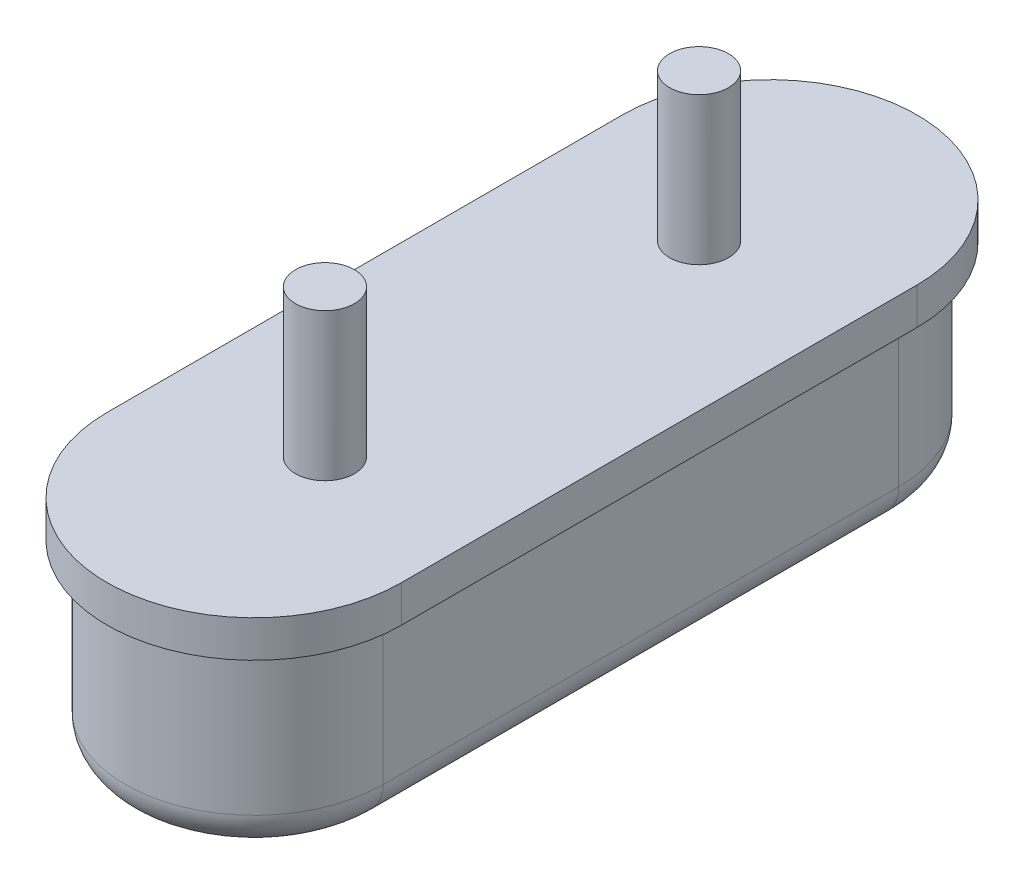
from build123d import *

# Parameters (mm, degrees)
BOSS_EXTRUDE1_DEPTH = 3
CUT_EXTRUDE1_START  = -2.5
CUT_EXTRUDE1_DEPTH  = 2.5
FILLET1_R           = 0.5
SKETCH3_R           = 0.4
BOSS_EXTRUDE2_DEPTH = 2
CUT_EXTRUDE2_DEPTH  = 0.05
FILLET2_R           = 0.1


with BuildPart() as part:
    # Sketch1 → Boss-Extrude1 (new body)
    with BuildSketch(Plane.XZ):
        with BuildLine():
            Line((2, 3.5), (2, -3.5))
            ThreePointArc((2, -3.5), (0, -5.5), (-2, -3.5))
            Line((-2, -3.5), (-2, 3.5))
            ThreePointArc((-2, 3.5), (0, 5.5), (2, 3.5))
        make_face()
    extrude(amount=BOSS_EXTRUDE1_DEPTH)

    # Sketch2 → Cut-Extrude1 (cut)
    with BuildSketch(Plane.XZ.offset(3).offset(CUT_EXTRUDE1_START)):
        with BuildLine():
            Line((2, 3.5), (2, -3.5))
            ThreePointArc((2, -3.5), (0, -5.5), (-2, -3.5))
            Line((-2, -3.5), (-2, 3.5))
            ThreePointArc((-2, 3.5), (0, 5.5), (2, 3.5))
        make_face()
        with BuildLine():
            Line((1.75, 3.5), (1.75, -3.5))
            ThreePointArc((1.75, -3.5), (0, -5.25), (-1.75, -3.5))
            Line((-1.75, -3.5), (-1.75, 3.5))
            ThreePointArc((-1.75, 3.5), (0, 5.25), (1.75, 3.5))
        make_face(mode=Mode.SUBTRACT)
    extrude(amount=CUT_EXTRUDE1_DEPTH, mode=Mode.SUBTRACT)

    # Fillet1
    fillet1_edges = [part.edges().sort_by_distance(p)[0] for p in [
        (0, -3, -5.25),
        (1.75, -3, 0),
        (0, -3, 5.25),
        (-1.75, -3, 0),
    ]]
    fillet(fillet1_edges, radius=FILLET1_R)

    # Sketch3 → Boss-Extrude2 (add)
    with BuildSketch(Plane(origin=(0, 0, 0), x_dir=(1, 0, 0), z_dir=(0, 1, 0))):
        with Locations((0, 2.54)):
            Circle(SKETCH3_R)
        with Locations((0, -2.54)):
            Circle(SKETCH3_R)
    extrude(amount=BOSS_EXTRUDE2_DEPTH)

    # Sketch4 → Cut-Extrude2 (cut)
    # profile 1 of 10: a face of its own
    with BuildSketch(Plane.XZ.offset(3)):
        with BuildLine():
            add(Edge.make_bspline(
                [(-0.455693493, -2.719669553), (-0.454052299, -2.717742187), (-0.45091746, -2.714060734), (-0.445315879, -2.709924595), (-0.439274547, -2.707354954), (-0.435097795, -2.707003283), (-0.433005137, -2.706827087)],
                knots=[0, 0, 0, 0, 1.123151834, 2.145327845, 3.070762522, 4, 4, 4, 4], degree=3))
            add(Edge.make_bspline(
                [(-0.433005137, -2.706827087), (-0.429264089, -2.707058472), (-0.422218418, -2.707494248), (-0.412509892, -2.711149986), (-0.404998663, -2.717805901), (-0.40187447, -2.72354653), (-0.400256849, -2.726518868)],
                knots=[0, 0, 0, 0, 1.103829111, 2.078887027, 3.005301256, 4, 4, 4, 4], degree=3))
            add(Edge.make_bspline(
                [(-0.400256849, -2.726518868), (-0.399431529, -2.728776269), (-0.398108355, -2.732395388), (-0.397647656, -2.736212711), (-0.397474315, -2.737649005)],
                knots=[0, 0, 0, 0, 1.247486438, 2, 2, 2, 2], degree=3))
            add(Edge.make_bspline(
                [(-0.397474315, -2.737649005), (-0.397879817, -2.740597373), (-0.398883448, -2.74789468), (-0.403174333, -2.758696795), (-0.407427859, -2.769118295), (-0.409352206, -2.775735841), (-0.41010274, -2.778316813)],
                knots=[0, 0, 0, 0, 0.834115317, 2.06446299, 3.24510253, 4, 4, 4, 4], degree=3))
            add(Edge.make_bspline(
                [(-0.41010274, -2.778316813), (-0.41552906, -2.796866469), (-0.426127974, -2.833098427), (-0.43680466, -2.887387776), (-0.443979055, -2.939867782), (-0.444801637, -2.974355929), (-0.445205479, -2.991287704)],
                knots=[0, 0, 0, 0, 1.070143053, 2.090247768, 3.06241719, 4, 4, 4, 4], degree=3))
            add(Edge.make_bspline(
                [(-0.445205479, -2.991287704), (-0.445205479, -2.992714644), (-0.445205479, -2.996496037), (-0.445205479, -3.00027743), (-0.445205479, -3.002631882)],
                knots=[0, 0, 0, 0, 0.754716981, 2, 2, 2, 2], degree=3))
            add(Edge.make_bspline(
                [(-0.445205479, -3.002631882), (-0.445205479, -3.004700946), (-0.445205479, -3.008410991), (-0.445205479, -3.012121037), (-0.445205479, -3.013762019)],
                knots=[0, 0, 0, 0, 1.115384615, 2, 2, 2, 2], degree=3))
            add(Edge.make_bspline(
                [(-0.445205479, -3.013762019), (-0.444604909, -3.018918862), (-0.443409192, -3.02918598), (-0.439628474, -3.044126756), (-0.43478806, -3.058701938), (-0.428039153, -3.072519701), (-0.420132183, -3.085918984), (-0.410637769, -3.098599105), (-0.399588733, -3.110622364), (-0.383382492, -3.125745698), (-0.361097963, -3.141813743), (-0.332417147, -3.156244113), (-0.302022322, -3.165024502), (-0.281234733, -3.166063777), (-0.270761986, -3.166587361)],
                knots=[0, 0, 0, 0, 0.737223551, 1.467789844, 2.186217636, 2.916572712, 3.648826552, 4.395270522, 5.163445613, 5.967152366, 7.54345389, 9.049273149, 10.513429621, 12, 12, 12, 12], degree=3))
            add(Edge.make_bspline(
                [(-0.270761986, -3.166587361), (-0.264258122, -3.166449336), (-0.251473309, -3.166178017), (-0.232768732, -3.163251881), (-0.214901332, -3.158799551), (-0.197904959, -3.152541012), (-0.181683722, -3.14462467), (-0.166496105, -3.134642809), (-0.151942713, -3.123092156), (-0.143306038, -3.114042059), (-0.138912671, -3.109438389)],
                knots=[0, 0, 0, 0, 1.05273353, 2.069385422, 3.058871978, 4.031475575, 4.998017562, 5.975757643, 6.970293492, 8, 8, 8, 8], degree=3))
            Line((-0.138912671, -3.109438389), (-0.119006849, -3.08246921))
            Line((-0.119006849, -3.08246921), (0.045376712, -2.755842498))
            add(Edge.make_bspline(
                [(0.045376712, -2.755842498), (0.051595303, -2.747117368), (0.063738078, -2.730080181), (0.085032192, -2.707745841), (0.107702136, -2.688358588), (0.132555302, -2.672972318), (0.158970523, -2.660734546), (0.18715264, -2.652286987), (0.217049464, -2.646943789), (0.237562162, -2.646345832), (0.24807363, -2.646039416)],
                knots=[0, 0, 0, 0, 1.066206558, 2.081935809, 3.065751716, 4.030169453, 4.984343245, 5.957937679, 6.953571388, 8, 8, 8, 8], degree=3))
            add(Edge.make_bspline(
                [(0.24807363, -2.646039416), (0.25293351, -2.646064039), (0.261027881, -2.646105049), (0.269053326, -2.647128668), (0.272260274, -2.647537704)],
                knots=[0, 0, 0, 0, 1.200805017, 2, 2, 2, 2], degree=3))
            add(Edge.make_bspline(
                [(0.272260274, -2.647537704), (0.282382778, -2.648952883), (0.302688959, -2.651791793), (0.332326756, -2.661533665), (0.360977572, -2.675633356), (0.388307111, -2.693762263), (0.413506675, -2.714935284), (0.435149021, -2.739050093), (0.453293365, -2.765211797), (0.462032313, -2.784374261), (0.466395548, -2.793941813)],
                knots=[0, 0, 0, 0, 0.961840898, 1.929494427, 2.924998625, 3.963894652, 5.013530698, 6.018236918, 7.01053329, 8, 8, 8, 8], degree=3))
            add(Edge.make_bspline(
                [(0.466395548, -2.793941813), (0.469497243, -2.802089979), (0.475661264, -2.818282885), (0.481735877, -2.84343494), (0.485523249, -2.868882721), (0.486041324, -2.885966163), (0.48630137, -2.894541128)],
                knots=[0, 0, 0, 0, 1.013198682, 2.013536909, 3.002902805, 4, 4, 4, 4], degree=3))
            add(Edge.make_bspline(
                [(0.48630137, -2.894541128), (0.485731245, -2.908765347), (0.484541458, -2.938449734), (0.476816912, -2.984453083), (0.464347825, -3.033607587), (0.452748629, -3.066854882), (0.446703767, -3.084181539)],
                knots=[0, 0, 0, 0, 0.876921522, 1.830039204, 2.869136069, 4, 4, 4, 4], degree=3))
            add(Edge.make_bspline(
                [(0.446703767, -3.084181539), (0.441342974, -3.097543204), (0.430823321, -3.123763216), (0.411748657, -3.161036441), (0.390514575, -3.195890285), (0.374123667, -3.217236752), (0.366010274, -3.227803115)],
                knots=[0, 0, 0, 0, 1.043998492, 2.048670962, 3.034104776, 4, 4, 4, 4], degree=3))
            add(Edge.make_bspline(
                [(0.366010274, -3.227803115), (0.363489839, -3.229872548), (0.358379153, -3.234068738), (0.351795633, -3.234740196), (0.348458904, -3.235080512)],
                knots=[0, 0, 0, 0, 0.986338914, 2, 2, 2, 2], degree=3))
            add(Edge.make_bspline(
                [(0.348458904, -3.235080512), (0.346869074, -3.234945119), (0.343284634, -3.23463986), (0.340008166, -3.233135242), (0.338184932, -3.232297978)],
                knots=[0, 0, 0, 0, 0.887072906, 2, 2, 2, 2], degree=3))
            add(Edge.make_bspline(
                [(0.338184932, -3.232297978), (0.334650287, -3.231008869), (0.328100806, -3.22862023), (0.320261788, -3.222045189), (0.315415317, -3.213492588), (0.314902793, -3.207102079), (0.314640411, -3.203830512)],
                knots=[0, 0, 0, 0, 1.12649361, 2.087323689, 3.020821353, 4, 4, 4, 4], degree=3))
            add(Edge.make_bspline(
                [(0.314640411, -3.203830512), (0.314838601, -3.200937569), (0.315246824, -3.194978821), (0.317672969, -3.189517237), (0.318921233, -3.186707224)],
                knots=[0, 0, 0, 0, 0.970990099, 2, 2, 2, 2], degree=3))
            add(Edge.make_bspline(
                [(0.318921233, -3.186707224), (0.326807584, -3.174543932), (0.342407563, -3.150483742), (0.362400266, -3.112903022), (0.379727574, -3.074955568), (0.393640129, -3.036360341), (0.404400809, -2.997202152), (0.412046637, -2.957558757), (0.417017162, -2.917355874), (0.41754368, -2.890346195), (0.417808219, -2.876775717)],
                knots=[0, 0, 0, 0, 1.052998489, 2.082934739, 3.090014684, 4.082250997, 5.060833939, 6.038001165, 7.014232617, 8, 8, 8, 8], degree=3))
            add(Edge.make_bspline(
                [(0.417808219, -2.876775717), (0.417213323, -2.87126207), (0.416036701, -2.860356844), (0.412220457, -2.844499493), (0.407454525, -2.829115357), (0.400579211, -2.814572204), (0.392827436, -2.800374527), (0.383176895, -2.787023133), (0.372295332, -2.774139318), (0.355898719, -2.758174923), (0.333778074, -2.740759943), (0.304374955, -2.725638218), (0.273191895, -2.716219333), (0.251634037, -2.715096866), (0.240796233, -2.714532567)],
                knots=[0, 0, 0, 0, 0.759082945, 1.501360362, 2.230976094, 2.961573592, 3.70127141, 4.444513868, 5.214348523, 6.009346189, 7.577583571, 9.051056227, 10.517474458, 12, 12, 12, 12], degree=3))
            add(Edge.make_bspline(
                [(0.240796233, -2.714532567), (0.231204054, -2.714963732), (0.212397965, -2.71580906), (0.185169632, -2.721863862), (0.159810167, -2.732141581), (0.144893606, -2.742224993), (0.137414384, -2.747280854)],
                knots=[0, 0, 0, 0, 1.043203148, 2.045267505, 3.019889533, 4, 4, 4, 4], degree=3))
            add(Edge.make_bspline(
                [(0.137414384, -2.747280854), (0.131568128, -2.752130075), (0.119528669, -2.762116294), (0.103531649, -2.780532877), (0.088286599, -2.801605995), (0.079602792, -2.817312838), (0.075128425, -2.825405854)],
                knots=[0, 0, 0, 0, 0.904242437, 1.862147382, 2.898462603, 4, 4, 4, 4], degree=3))
            add(Edge.make_bspline(
                [(0.075128425, -2.825405854), (0.067965018, -2.84012456), (0.053596477, -2.869647707), (0.038713233, -2.898914762), (0.03125, -2.913590786)],
                knots=[0, 0, 0, 0, 0.997095991, 2, 2, 2, 2], degree=3))
            Line((0.03125, -2.913590786), (-0.070633562, -3.119926402))
            add(Edge.make_bspline(
                [(-0.070633562, -3.119926402), (-0.076830757, -3.129089484), (-0.088921225, -3.146966271), (-0.110444373, -3.170323977), (-0.133304988, -3.190602734), (-0.158483121, -3.206671972), (-0.185176295, -3.21951854), (-0.213806057, -3.228431924), (-0.244196242, -3.234283049), (-0.26516862, -3.234810596), (-0.275898973, -3.235080512)],
                knots=[0, 0, 0, 0, 1.075829312, 2.098897729, 3.083886839, 4.04363121, 4.997725526, 5.960157101, 6.956330352, 8, 8, 8, 8], degree=3))
            add(Edge.make_bspline(
                [(-0.275898973, -3.235080512), (-0.279754506, -3.234983174), (-0.287763678, -3.234780972), (-0.295736689, -3.2339916), (-0.299871575, -3.233582224)],
                knots=[0, 0, 0, 0, 0.962779383, 2, 2, 2, 2], degree=3))
            add(Edge.make_bspline(
                [(-0.299871575, -3.233582224), (-0.310137043, -3.23201127), (-0.330721536, -3.228861165), (-0.36065002, -3.218933432), (-0.389598679, -3.205074659), (-0.417085208, -3.187422329), (-0.442455469, -3.166845972), (-0.463944565, -3.143160943), (-0.482301246, -3.117566324), (-0.490949733, -3.098616771), (-0.495291096, -3.089104484)],
                knots=[0, 0, 0, 0, 0.979088105, 1.963284269, 2.963623745, 4.002614083, 5.041080185, 6.037533597, 7.014882131, 8, 8, 8, 8], degree=3))
            add(Edge.make_bspline(
                [(-0.495291096, -3.089104484), (-0.498212261, -3.081317721), (-0.504166334, -3.06544633), (-0.50929197, -3.039892432), (-0.513292081, -3.012818122), (-0.513560402, -2.994087602), (-0.51369863, -2.984438389)],
                knots=[0, 0, 0, 0, 0.932067178, 1.899788189, 2.918055019, 4, 4, 4, 4], degree=3))
            add(Edge.make_bspline(
                [(-0.51369863, -2.984438389), (-0.513351448, -2.971294231), (-0.512620575, -2.943623706), (-0.506798088, -2.900462903), (-0.498097784, -2.853554849), (-0.489789047, -2.821435823), (-0.485445205, -2.804643868)],
                knots=[0, 0, 0, 0, 0.864098311, 1.819063323, 2.859797586, 4, 4, 4, 4], degree=3))
            add(Edge.make_bspline(
                [(-0.485445205, -2.804643868), (-0.483068979, -2.796281435), (-0.478540272, -2.780343978), (-0.471302276, -2.757817199), (-0.463883951, -2.737776771), (-0.458327435, -2.725492592), (-0.455693493, -2.719669553)],
                knots=[0, 0, 0, 0, 1.157267687, 2.20556675, 3.149389165, 4, 4, 4, 4], degree=3))
        make_face()
    # profile 2 of 10: a face of its own
    with BuildSketch(Plane.XZ.offset(3)):
        with BuildLine():
            add(Edge.make_bspline(
                [(-0.51369863, -2.094241471), (-0.513528222, -2.087599512), (-0.513187967, -2.074337478), (-0.510610524, -2.054531794), (-0.505946846, -2.035059532), (-0.500129444, -2.015685116), (-0.491968912, -1.996856203), (-0.482619021, -1.978065743), (-0.471219544, -1.959714581), (-0.453902707, -1.93603194), (-0.429982687, -1.908551441), (-0.397832755, -1.880337534), (-0.362712877, -1.857494471), (-0.337369192, -1.846803273), (-0.324700342, -1.841458937)],
                knots=[0, 0, 0, 0, 0.715319174, 1.428281714, 2.145949783, 2.870252072, 3.603830021, 4.353019454, 5.12930605, 5.927051846, 7.51164333, 9.042016745, 10.521357733, 12, 12, 12, 12], degree=3))
            add(Edge.make_bspline(
                [(-0.324700342, -1.841458937), (-0.316746786, -1.838832877), (-0.300867738, -1.833590024), (-0.276598968, -1.828087667), (-0.252092411, -1.824731289), (-0.235741178, -1.824325495), (-0.227525685, -1.824121608)],
                knots=[0, 0, 0, 0, 1.012942066, 2.022309834, 3.006331903, 4, 4, 4, 4], degree=3))
            add(Edge.make_bspline(
                [(-0.227525685, -1.824121608), (-0.217591986, -1.824333184), (-0.198065814, -1.824749069), (-0.169504279, -1.829070485), (-0.142066305, -1.835374892), (-0.115882898, -1.844539281), (-0.091149686, -1.856774919), (-0.067399325, -1.871150849), (-0.04484105, -1.888205518), (-0.031255164, -1.901521469), (-0.024400685, -1.908239758)],
                knots=[0, 0, 0, 0, 1.05355145, 2.070913016, 3.059082178, 4.038625458, 5.007219172, 5.982538493, 6.982131288, 8, 8, 8, 8], degree=3))
            add(Edge.make_bspline(
                [(-0.024400685, -1.908239758), (-0.017544458, -1.91582044), (-0.003963703, -1.930836186), (0.013625134, -1.955366775), (0.028425985, -1.981227202), (0.040822292, -2.008227908), (0.049897859, -2.036826961), (0.056805492, -2.066504025), (0.0609805, -2.097547677), (0.061420306, -2.118629456), (0.061643836, -2.12934421)],
                knots=[0, 0, 0, 0, 1.007274285, 1.995199957, 2.969022675, 3.941930145, 4.918594813, 5.922053884, 6.94388981, 8, 8, 8, 8], degree=3))
            Line((0.061643836, -2.12934421), (0.061643836, -2.344669553))
            Line((0.061643836, -2.344669553), (0.464469178, -2.344669553))
            add(Edge.make_bspline(
                [(0.464469178, -2.344669553), (0.467067359, -2.345719868), (0.472262861, -2.347820151), (0.478608627, -2.354272906), (0.483454632, -2.362913875), (0.485312547, -2.369725675), (0.48630137, -2.37335106)],
                knots=[0, 0, 0, 0, 0.882085567, 1.763879777, 2.80988923, 4, 4, 4, 4], degree=3))
            add(Edge.make_bspline(
                [(0.48630137, -2.37335106), (0.485826357, -2.378328512), (0.484879848, -2.388246575), (0.478963665, -2.400073086), (0.469979311, -2.407211367), (0.459398505, -2.410840857), (0.445414835, -2.412651816), (0.434937843, -2.412980953), (0.429152397, -2.413162704)],
                knots=[0, 0, 0, 0, 1.118428376, 2.228578797, 2.843546727, 3.649160504, 4.701854983, 6, 6, 6, 6], degree=3))
            Line((0.429152397, -2.413162704), (-0.490796233, -2.413162704))
            add(Edge.make_bspline(
                [(-0.490796233, -2.413162704), (-0.494796377, -2.411371877), (-0.502827235, -2.407776539), (-0.508212975, -2.400816785), (-0.510916096, -2.397323663)],
                knots=[0, 0, 0, 0, 0.996193528, 2, 2, 2, 2], degree=3))
            Line((-0.510916096, -2.397323663), (-0.51369863, -2.387263731))
            Line((-0.51369863, -2.387263731), (-0.51369863, -2.094241471))
        make_face()
        with BuildLine():
            Line((-0.445205479, -2.094669553), (-0.445205479, -2.344669553))
            Line((-0.445205479, -2.344669553), (-0.006849315, -2.344669553))
            Line((-0.006849315, -2.344669553), (-0.006849315, -2.117143868))
            add(Edge.make_bspline(
                [(-0.006849315, -2.117143868), (-0.007075293, -2.10870861), (-0.007522315, -2.092022285), (-0.011723941, -2.06744246), (-0.018643158, -2.043786719), (-0.028072273, -2.020894969), (-0.040437547, -1.999019949), (-0.055228774, -1.97790999), (-0.072995193, -1.957845277), (-0.086425581, -1.945575893), (-0.093321918, -1.939275717)],
                knots=[0, 0, 0, 0, 0.990168394, 1.958715646, 2.918778046, 3.88059452, 4.859814791, 5.864243612, 6.903315664, 8, 8, 8, 8], degree=3))
            add(Edge.make_bspline(
                [(-0.093321918, -1.939275717), (-0.097955811, -1.935532797), (-0.107183124, -1.92807965), (-0.122317055, -1.918787474), (-0.137972181, -1.910519546), (-0.154508994, -1.903815256), (-0.171934055, -1.899017804), (-0.190025203, -1.895375297), (-0.208834005, -1.892859162), (-0.22166693, -1.892696938), (-0.228167808, -1.892614758)],
                knots=[0, 0, 0, 0, 0.979790498, 1.951023092, 2.917769928, 3.892831032, 4.881942733, 5.888684581, 6.930453953, 8, 8, 8, 8], degree=3))
            add(Edge.make_bspline(
                [(-0.228167808, -1.892614758), (-0.235603172, -1.892800211), (-0.250188954, -1.89316401), (-0.271579481, -1.896639425), (-0.292307348, -1.901483358), (-0.305352529, -1.906848517), (-0.311857877, -1.909524005)],
                knots=[0, 0, 0, 0, 1.036956728, 2.034174045, 3.019685471, 4, 4, 4, 4], degree=3))
            add(Edge.make_bspline(
                [(-0.311857877, -1.909524005), (-0.320856811, -1.913826118), (-0.3388743, -1.922439724), (-0.363430747, -1.940321164), (-0.386211157, -1.961306117), (-0.40639612, -1.985452245), (-0.423609078, -2.011333133), (-0.435836789, -2.038605048), (-0.443962501, -2.06637788), (-0.44479245, -2.085268503), (-0.445205479, -2.094669553)],
                knots=[0, 0, 0, 0, 0.994982126, 1.992133557, 3.021473572, 4.084156812, 5.130374186, 6.11645094, 7.062638743, 8, 8, 8, 8], degree=3))
        make_face(mode=Mode.SUBTRACT)
    # profile 3 of 10: a face of its own
    with BuildSketch(Plane.XZ.offset(3)):
        with BuildLine():
            add(Edge.make_bspline(
                [(-0.495077055, -1.013547978), (-0.492676025, -1.012714013), (-0.48856912, -1.011287535), (-0.484244809, -1.010918662), (-0.48244863, -1.010765443)],
                knots=[0, 0, 0, 0, 1.169264719, 2, 2, 2, 2], degree=3))
            add(Edge.make_bspline(
                [(-0.48244863, -1.010765443), (-0.478616231, -1.011167432), (-0.47068719, -1.011999127), (-0.464329371, -1.016830761), (-0.461044521, -1.019327087)],
                knots=[0, 0, 0, 0, 0.966674081, 2, 2, 2, 2], degree=3))
            Line((-0.461044521, -1.019327087), (-0.126284247, -1.322195238))
            Line((-0.126284247, -1.322195238), (0.447773973, -1.006484621))
            add(Edge.make_bspline(
                [(0.447773973, -1.006484621), (0.451060806, -1.006553735), (0.457023404, -1.006679113), (0.465134169, -1.007847237), (0.471530794, -1.010100011), (0.474782539, -1.012480133), (0.476241438, -1.013547978)],
                knots=[0, 0, 0, 0, 1.31758118, 2.390205438, 3.277763939, 4, 4, 4, 4], degree=3))
            add(Edge.make_bspline(
                [(0.476241438, -1.013547978), (0.479148913, -1.017972867), (0.485005098, -1.026885403), (0.485867256, -1.037517917), (0.48630137, -1.042871608)],
                knots=[0, 0, 0, 0, 0.992958702, 2, 2, 2, 2], degree=3))
            add(Edge.make_bspline(
                [(0.48630137, -1.042871608), (0.485290299, -1.04571805), (0.48340091, -1.051037202), (0.478736666, -1.057697161), (0.473035183, -1.062729634), (0.468465079, -1.064474203), (0.466181507, -1.065345923)],
                knots=[0, 0, 0, 0, 1.148250895, 2.145738409, 3.073469419, 4, 4, 4, 4], degree=3))
            Line((0.466181507, -1.065345923), (-0.078981164, -1.362863046))
            Line((-0.078981164, -1.362863046), (0.101241438, -1.522751745))
            Line((0.101241438, -1.522751745), (0.463398973, -1.522751745))
            add(Edge.make_bspline(
                [(0.463398973, -1.522751745), (0.466653472, -1.524229421), (0.473479217, -1.527328588), (0.480168108, -1.536825878), (0.485477562, -1.547132029), (0.486032952, -1.55479373), (0.48630137, -1.558496608)],
                knots=[0, 0, 0, 0, 0.938899355, 1.969177755, 3.018509487, 4, 4, 4, 4], degree=3))
            add(Edge.make_bspline(
                [(0.48630137, -1.558496608), (0.486175281, -1.560230416), (0.485899093, -1.56402818), (0.484356942, -1.567516772), (0.483518836, -1.569412704)],
                knots=[0, 0, 0, 0, 0.913067909, 2, 2, 2, 2], degree=3))
            add(Edge.make_bspline(
                [(0.483518836, -1.569412704), (0.481727308, -1.572883526), (0.477938531, -1.580223728), (0.465275313, -1.586711363), (0.449013289, -1.590888853), (0.436406883, -1.591117308), (0.429366438, -1.591244895)],
                knots=[0, 0, 0, 0, 0.740913191, 1.566905858, 2.641161788, 4, 4, 4, 4], degree=3))
            Line((0.429366438, -1.591244895), (-0.489511986, -1.591244895))
            add(Edge.make_bspline(
                [(-0.489511986, -1.591244895), (-0.493151288, -1.589611605), (-0.500177494, -1.586458297), (-0.508116314, -1.578213673), (-0.513045003, -1.567820226), (-0.51347167, -1.560197158), (-0.51369863, -1.556142156)],
                knots=[0, 0, 0, 0, 1.040780064, 2.009378633, 2.941112224, 4, 4, 4, 4], degree=3))
            add(Edge.make_bspline(
                [(-0.51369863, -1.556142156), (-0.513576549, -1.552596651), (-0.513346742, -1.545922558), (-0.509433651, -1.537091849), (-0.503657572, -1.529750039), (-0.498154907, -1.527118092), (-0.495291096, -1.52574832)],
                knots=[0, 0, 0, 0, 1.112554645, 2.094284351, 3.00818775, 4, 4, 4, 4], degree=3))
            Line((-0.495291096, -1.52574832), (-0.479666096, -1.522751745))
            Line((-0.479666096, -1.522751745), (0.004494863, -1.522751745))
            Line((0.004494863, -1.522751745), (-0.013912671, -1.504558252))
            Line((-0.013912671, -1.504558252), (-0.506635274, -1.061279142))
            add(Edge.make_bspline(
                [(-0.506635274, -1.061279142), (-0.508679512, -1.057369846), (-0.511953026, -1.051109747), (-0.513222075, -1.044187002), (-0.51369863, -1.041587361)],
                knots=[0, 0, 0, 0, 1.248956491, 2, 2, 2, 2], degree=3))
            add(Edge.make_bspline(
                [(-0.51369863, -1.041587361), (-0.513439183, -1.040153873), (-0.512709078, -1.036119932), (-0.510223859, -1.02896096), (-0.504912832, -1.019984972), (-0.498526262, -1.015805301), (-0.495077055, -1.013547978)],
                knots=[0, 0, 0, 0, 0.500659177, 1.408892098, 2.600615059, 4, 4, 4, 4], degree=3))
        make_face()
    # profile 4 of 10: a face of its own
    with BuildSketch(Plane.XZ.offset(3)):
        with BuildLine():
            Line((-0.496575342, -0.485936676), (-0.48244863, -0.481655854))
            Line((-0.48244863, -0.481655854), (0.463613014, -0.481655854))
            add(Edge.make_bspline(
                [(0.463613014, -0.481655854), (0.466686269, -0.483038704), (0.474251864, -0.486442938), (0.479126224, -0.493243048), (0.482020548, -0.497280854)],
                knots=[0, 0, 0, 0, 0.812429336, 2, 2, 2, 2], degree=3))
            add(Edge.make_bspline(
                [(0.482020548, -0.497280854), (0.483268997, -0.500453159), (0.485813804, -0.506919505), (0.486136821, -0.513863404), (0.48630137, -0.517400717)],
                knots=[0, 0, 0, 0, 0.981173826, 2, 2, 2, 2], degree=3))
            add(Edge.make_bspline(
                [(0.48630137, -0.517400717), (0.486175281, -0.519134526), (0.485899093, -0.52293229), (0.484356942, -0.526420882), (0.483518836, -0.528316813)],
                knots=[0, 0, 0, 0, 0.913067909, 2, 2, 2, 2], degree=3))
            add(Edge.make_bspline(
                [(0.483518836, -0.528316813), (0.481727308, -0.531787636), (0.477938531, -0.539127837), (0.465275313, -0.545615472), (0.449013289, -0.549792962), (0.436406883, -0.550021417), (0.429366438, -0.550149005)],
                knots=[0, 0, 0, 0, 0.740913191, 1.566905858, 2.641161788, 4, 4, 4, 4], degree=3))
            Line((0.429366438, -0.550149005), (-0.404751712, -0.550149005))
            Line((-0.404751712, -0.550149005), (-0.247431507, -0.706613046))
            add(Edge.make_bspline(
                [(-0.247431507, -0.706613046), (-0.246183018, -0.708988897), (-0.243646875, -0.713815126), (-0.243317776, -0.719259686), (-0.243150685, -0.722024005)],
                knots=[0, 0, 0, 0, 0.984557722, 2, 2, 2, 2], degree=3))
            add(Edge.make_bspline(
                [(-0.243150685, -0.722024005), (-0.2432256, -0.722093394), (-0.243788898, -0.722615142), (-0.243674535, -0.724949736), (-0.244888716, -0.728454255), (-0.245844223, -0.733626221), (-0.247805494, -0.739208783), (-0.251379314, -0.744440599), (-0.256695836, -0.748475206), (-0.260872681, -0.750361436), (-0.263056507, -0.751347635)],
                knots=[0, 0, 0, 0, 0.064375906, 0.484055469, 1.323414594, 2.493746615, 3.804393269, 5.079783794, 6.473191324, 8, 8, 8, 8], degree=3))
            add(Edge.make_bspline(
                [(-0.263056507, -0.751347635), (-0.264993956, -0.752596196), (-0.268846645, -0.755079006), (-0.27341428, -0.755446012), (-0.275684932, -0.755628457)],
                knots=[0, 0, 0, 0, 1.005764603, 2, 2, 2, 2], degree=3))
            add(Edge.make_bspline(
                [(-0.275684932, -0.755628457), (-0.279764303, -0.754869286), (-0.289096655, -0.753132536), (-0.295990934, -0.746512351), (-0.299871575, -0.742785991)],
                knots=[0, 0, 0, 0, 0.874243092, 2, 2, 2, 2], degree=3))
            add(Edge.make_bspline(
                [(-0.299871575, -0.742785991), (-0.302816624, -0.739880261), (-0.307952795, -0.734812659), (-0.31422484, -0.728173318), (-0.318423682, -0.72402357), (-0.320419977, -0.722024454), (-0.321061644, -0.721381882)],
                knots=[0, 0, 0, 0, 1.648173323, 2.874418218, 3.638205856, 4, 4, 4, 4], degree=3))
            Line((-0.321061644, -0.721381882), (-0.509417808, -0.528744895))
            add(Edge.make_bspline(
                [(-0.509417808, -0.528744895), (-0.510664378, -0.526512475), (-0.513367832, -0.521670993), (-0.51358279, -0.516114353), (-0.51369863, -0.513119895)],
                knots=[0, 0, 0, 0, 0.922205455, 2, 2, 2, 2], degree=3))
            add(Edge.make_bspline(
                [(-0.51369863, -0.513119895), (-0.513520826, -0.510018489), (-0.513182837, -0.504123006), (-0.509866216, -0.49606683), (-0.504233647, -0.489635001), (-0.499188055, -0.487198399), (-0.496575342, -0.485936676)],
                knots=[0, 0, 0, 0, 1.081312712, 2.055474573, 2.993084101, 4, 4, 4, 4], degree=3))
        make_face()
    # profile 5 of 10: a face of its own
    with BuildSketch(Plane.XZ.offset(3)):
        with BuildLine():
            add(Edge.make_bspline(
                [(-0.496789384, 0.134568461), (-0.494960695, 0.135398612), (-0.490564244, 0.137394422), (-0.485711168, 0.137367007), (-0.482876712, 0.137350995)],
                knots=[0, 0, 0, 0, 0.831893338, 2, 2, 2, 2], degree=3))
            add(Edge.make_bspline(
                [(-0.482876712, 0.137350995), (-0.478573608, 0.137235233), (-0.470803722, 0.137026209), (-0.464647485, 0.132366649), (-0.461900685, 0.130287639)],
                knots=[0, 0, 0, 0, 1.10763643, 2, 2, 2, 2], degree=3))
            add(Edge.make_bspline(
                [(-0.461900685, 0.130287639), (-0.460353591, 0.126852409), (-0.456919419, 0.119227038), (-0.450720636, 0.106937461), (-0.444285331, 0.091976741), (-0.439317364, 0.081399396), (-0.436643836, 0.075707159)],
                knots=[0, 0, 0, 0, 0.751643541, 1.668465315, 2.745276287, 4, 4, 4, 4], degree=3))
            add(Edge.make_bspline(
                [(-0.436643836, 0.075707159), (-0.432606954, 0.067732617), (-0.424578875, 0.051873779), (-0.410744275, 0.029080196), (-0.395574984, 0.007287959), (-0.379003814, -0.013599953), (-0.360975519, -0.033533177), (-0.341529525, -0.05254359), (-0.320644722, -0.070610255), (-0.298533553, -0.087577387), (-0.275569294, -0.10336702), (-0.251987845, -0.117537717), (-0.228016661, -0.129924446), (-0.203746993, -0.140740849), (-0.179028692, -0.149664098), (-0.154011733, -0.157304622), (-0.128493015, -0.162799741), (-0.111316805, -0.165325902), (-0.102739726, -0.166587361)],
                knots=[0, 0, 0, 0, 0.998886899, 1.98646957, 2.977684904, 3.965460795, 4.964984333, 5.980200136, 7.003622548, 8.050124837, 9.094314679, 10.117457344, 11.123419972, 12.108971539, 13.085444868, 14.059472157, 15.030981774, 16, 16, 16, 16], degree=3))
            Line((-0.102739726, -0.166587361), (-0.102739726, 0.012136954))
            add(Edge.make_bspline(
                [(-0.102739726, 0.012136954), (-0.102739726, 0.014491406), (-0.102739726, 0.020127821), (-0.102739726, 0.025764237), (-0.102739726, 0.0290462)],
                knots=[0, 0, 0, 0, 0.835443038, 2, 2, 2, 2], degree=3))
            add(Edge.make_bspline(
                [(-0.102739726, 0.0290462), (-0.102483857, 0.038627308), (-0.101984087, 0.05734136), (-0.097145583, 0.084538398), (-0.089250787, 0.110046728), (-0.077986628, 0.133767742), (-0.063729666, 0.15578066), (-0.04640643, 0.176158077), (-0.02573098, 0.194631611), (-0.010121527, 0.205166539), (-0.002140411, 0.21055305)],
                knots=[0, 0, 0, 0, 1.056467325, 2.063517609, 3.037174296, 3.995137979, 4.951676987, 5.923517476, 6.938294131, 8, 8, 8, 8], degree=3))
            add(Edge.make_bspline(
                [(-0.002140411, 0.21055305), (0.007129893, 0.215995968), (0.025276052, 0.22665021), (0.054558262, 0.237183825), (0.084232799, 0.243907548), (0.104272912, 0.244216827), (0.114297945, 0.244371543)],
                knots=[0, 0, 0, 0, 1.046831695, 2.049120918, 3.024075957, 4, 4, 4, 4], degree=3))
            add(Edge.make_bspline(
                [(0.114297945, 0.244371543), (0.117651256, 0.244371543), (0.1262129, 0.244371543), (0.140339612, 0.244371543), (0.155179795, 0.244371543), (0.164811644, 0.244371543), (0.168878425, 0.244371543)],
                knots=[0, 0, 0, 0, 0.737254902, 1.882352941, 3.105882353, 4, 4, 4, 4], degree=3))
            add(Edge.make_bspline(
                [(0.168878425, 0.244371543), (0.172945145, 0.244469299), (0.182505124, 0.244699104), (0.1920661, 0.244491077), (0.197559932, 0.244371543)],
                knots=[0, 0, 0, 0, 0.850780267, 2, 2, 2, 2], degree=3))
            add(Edge.make_bspline(
                [(0.197559932, 0.244371543), (0.202910959, 0.244371543), (0.211972032, 0.244371543), (0.221033105, 0.244371543), (0.224743151, 0.244371543)],
                knots=[0, 0, 0, 0, 1.181102362, 2, 2, 2, 2], degree=3))
            add(Edge.make_bspline(
                [(0.224743151, 0.244371543), (0.237526868, 0.244079359), (0.261383794, 0.243534087), (0.294508146, 0.23974967), (0.322435374, 0.232873215), (0.33820757, 0.225208662), (0.345462329, 0.221683187)],
                knots=[0, 0, 0, 0, 1.236389279, 2.307345107, 3.221427128, 4, 4, 4, 4], degree=3))
            add(Edge.make_bspline(
                [(0.345462329, 0.221683187), (0.355700432, 0.21656337), (0.375986325, 0.206418908), (0.403331769, 0.185808431), (0.427394194, 0.161155432), (0.448169545, 0.133122953), (0.46503828, 0.102673779), (0.477398529, 0.07073732), (0.484998673, 0.037678471), (0.485866536, 0.015243955), (0.48630137, 0.004003392)],
                knots=[0, 0, 0, 0, 1.002932261, 1.987221216, 2.987864099, 4.017243846, 5.040166864, 6.033199586, 7.01455664, 8, 8, 8, 8], degree=3))
            add(Edge.make_bspline(
                [(0.48630137, 0.004003392), (0.485989551, -0.00643522), (0.485381125, -0.02680324), (0.480111106, -0.056532195), (0.471360067, -0.084464394), (0.459007782, -0.11065361), (0.443233746, -0.13504885), (0.423957294, -0.157621757), (0.401344615, -0.178675571), (0.384082115, -0.190627317), (0.375214041, -0.196767156)],
                knots=[0, 0, 0, 0, 1.043019943, 2.03516033, 3.007511863, 3.961611943, 4.921242467, 5.903097857, 6.922781508, 8, 8, 8, 8], degree=3))
            add(Edge.make_bspline(
                [(0.375214041, -0.196767156), (0.365658356, -0.202619452), (0.347081924, -0.213996426), (0.317519571, -0.225851952), (0.288013702, -0.233767523), (0.268170912, -0.234645743), (0.258347603, -0.235080512)],
                knots=[0, 0, 0, 0, 1.076767979, 2.093257303, 3.056053954, 4, 4, 4, 4], degree=3))
            Line((0.258347603, -0.235080512), (-0.087756849, -0.235080512))
            add(Edge.make_bspline(
                [(-0.087756849, -0.235080512), (-0.099120193, -0.234831536), (-0.121812734, -0.234334333), (-0.155538705, -0.229089062), (-0.188828206, -0.221173246), (-0.22180651, -0.210296009), (-0.254155527, -0.195676014), (-0.286344764, -0.178445117), (-0.317921838, -0.157629009), (-0.348768187, -0.13412276), (-0.378217263, -0.10858212), (-0.40525355, -0.081422739), (-0.430010207, -0.053502682), (-0.451836942, -0.024160897), (-0.471504477, 0.005935308), (-0.488096675, 0.037431178), (-0.502754132, 0.069685871), (-0.510051311, 0.092110201), (-0.51369863, 0.103318461)],
                knots=[0, 0, 0, 0, 0.941905863, 1.880981384, 2.824076429, 3.778541592, 4.756210206, 5.765103377, 6.804165343, 7.889587126, 8.980239965, 10.034810052, 11.066446488, 12.072541108, 13.065706671, 14.045343687, 15.023012301, 16, 16, 16, 16], degree=3))
            add(Edge.make_bspline(
                [(-0.51369863, 0.103318461), (-0.513527348, 0.106847275), (-0.513204247, 0.113503931), (-0.509909984, 0.122525336), (-0.504562436, 0.130024512), (-0.49943099, 0.133024238), (-0.496789384, 0.134568461)],
                knots=[0, 0, 0, 0, 1.123566157, 2.119463788, 3.031922542, 4, 4, 4, 4], degree=3))
        make_face()
        with BuildLine():
            add(Edge.make_bspline(
                [(-0.034246575, 0.030330447), (-0.034246575, 0.0290462), (-0.034246575, 0.025764237), (-0.034246575, 0.022482274), (-0.034246575, 0.020484557)],
                knots=[0, 0, 0, 0, 0.782608696, 2, 2, 2, 2], degree=3))
            add(Edge.make_bspline(
                [(-0.034246575, 0.020484557), (-0.034246575, 0.018914922), (-0.034246575, 0.016203735), (-0.034246575, 0.013492548), (-0.034246575, 0.012350995)],
                knots=[0, 0, 0, 0, 1.157894737, 2, 2, 2, 2], degree=3))
            Line((-0.034246575, 0.012350995), (-0.034246575, -0.166587361))
            Line((-0.034246575, -0.166587361), (0.232020548, -0.166587361))
            add(Edge.make_bspline(
                [(0.232020548, -0.166587361), (0.239017468, -0.166460761), (0.252178165, -0.166222635), (0.270500425, -0.164592611), (0.286177131, -0.161870282), (0.295268251, -0.158502308), (0.299443493, -0.156955512)],
                knots=[0, 0, 0, 0, 1.225331249, 2.304758684, 3.221433238, 4, 4, 4, 4], degree=3))
            add(Edge.make_bspline(
                [(0.299443493, -0.156955512), (0.306170913, -0.154823556), (0.319731995, -0.150525975), (0.33864753, -0.139865301), (0.35664056, -0.126495364), (0.372988227, -0.110103406), (0.387549084, -0.092055398), (0.399568799, -0.072891425), (0.408224479, -0.052838084), (0.411774401, -0.039001989), (0.413527397, -0.032169553)],
                knots=[0, 0, 0, 0, 0.954587781, 1.924250725, 2.926421077, 3.986667277, 5.05324914, 6.065314844, 7.044628324, 8, 8, 8, 8], degree=3))
            add(Edge.make_bspline(
                [(0.413527397, -0.032169553), (0.414775772, -0.0258398), (0.417215674, -0.013468534), (0.417613796, -0.000866547), (0.417808219, 0.005287639)],
                knots=[0, 0, 0, 0, 1.02329908, 2, 2, 2, 2], degree=3))
            add(Edge.make_bspline(
                [(0.417808219, 0.005287639), (0.417413013, 0.014833691), (0.416630547, 0.033733857), (0.408569181, 0.061131302), (0.396365824, 0.087277516), (0.378891485, 0.11102156), (0.35846511, 0.132464233), (0.334762017, 0.149777104), (0.308615466, 0.163038393), (0.289717984, 0.16787309), (0.280179795, 0.170313324)],
                knots=[0, 0, 0, 0, 0.985510019, 1.951204696, 2.932250163, 3.958953589, 4.987752898, 5.986209191, 6.983572542, 8, 8, 8, 8], degree=3))
            add(Edge.make_bspline(
                [(0.280179795, 0.170313324), (0.275547893, 0.171129016), (0.26581783, 0.17284251), (0.250412396, 0.174892543), (0.233522862, 0.175508254), (0.221817365, 0.17575208), (0.215753425, 0.175878392)],
                knots=[0, 0, 0, 0, 0.87141024, 1.83053916, 2.876127847, 4, 4, 4, 4], degree=3))
            Line((0.215753425, 0.175878392), (0.120077055, 0.175878392))
            add(Edge.make_bspline(
                [(0.120077055, 0.175878392), (0.113789003, 0.175794872), (0.101743398, 0.175634877), (0.084442807, 0.173321215), (0.068553492, 0.170206356), (0.058823179, 0.166518509), (0.054152397, 0.164748255)],
                knots=[0, 0, 0, 0, 1.120683683, 2.146819472, 3.11042936, 4, 4, 4, 4], degree=3))
            add(Edge.make_bspline(
                [(0.054152397, 0.164748255), (0.047123199, 0.161297715), (0.033509956, 0.154615154), (0.015458079, 0.141796247), (-0.000133941, 0.127606635), (-0.012561541, 0.111370269), (-0.022481675, 0.093527001), (-0.029134637, 0.073859849), (-0.033703121, 0.05265683), (-0.034061857, 0.037919094), (-0.034246575, 0.030330447)],
                knots=[0, 0, 0, 0, 1.095659468, 2.121931709, 3.091098904, 4.038992922, 4.974147276, 5.938558555, 6.93853768, 8, 8, 8, 8], degree=3))
        make_face(mode=Mode.SUBTRACT)
    # profile 6 of 10: a face of its own
    with BuildSketch(Plane.XZ.offset(3)):
        with BuildLine():
            add(Edge.make_bspline(
                [(0.372003425, 0.549594146), (0.373654215, 0.551104144), (0.37707733, 0.55423531), (0.383631332, 0.557436578), (0.391331144, 0.559054058), (0.396753437, 0.559306713), (0.399614726, 0.559440036)],
                knots=[0, 0, 0, 0, 0.887547241, 1.840437375, 2.860420597, 4, 4, 4, 4], degree=3))
            add(Edge.make_bspline(
                [(0.399614726, 0.559440036), (0.40097032, 0.559440036), (0.404466324, 0.559440036), (0.407962329, 0.559440036), (0.41010274, 0.559440036)],
                knots=[0, 0, 0, 0, 0.775510204, 2, 2, 2, 2], degree=3))
            add(Edge.make_bspline(
                [(0.41010274, 0.559440036), (0.41252826, 0.559530339), (0.41709302, 0.559700285), (0.421660742, 0.559668822), (0.42380137, 0.559654077)],
                knots=[0, 0, 0, 0, 1.062715322, 2, 2, 2, 2], degree=3))
            Line((0.42380137, 0.559654077), (0.448202055, 0.559440036))
            add(Edge.make_bspline(
                [(0.448202055, 0.559440036), (0.451201578, 0.559288497), (0.456813618, 0.559004971), (0.464710943, 0.557674993), (0.471406084, 0.55474541), (0.47695962, 0.550781867), (0.481272327, 0.545528734), (0.484266541, 0.539221638), (0.48592802, 0.531768916), (0.486172315, 0.526485993), (0.48630137, 0.523695173)],
                knots=[0, 0, 0, 0, 1.204096452, 2.25283698, 3.187802858, 4.108668537, 4.961772408, 5.882638087, 6.881457154, 8, 8, 8, 8], degree=3))
            add(Edge.make_bspline(
                [(0.48630137, 0.523695173), (0.486138439, 0.522255457), (0.485710502, 0.518474055), (0.484224822, 0.514957039), (0.483304795, 0.512779077)],
                knots=[0, 0, 0, 0, 0.761471907, 2, 2, 2, 2], degree=3))
            add(Edge.make_bspline(
                [(0.483304795, 0.512779077), (0.481549613, 0.509368621), (0.478092224, 0.502650641), (0.468290863, 0.495797042), (0.45621136, 0.491380038), (0.447109479, 0.49109848), (0.442208904, 0.490946885)],
                knots=[0, 0, 0, 0, 0.91700229, 1.806328224, 2.818897717, 4, 4, 4, 4], degree=3))
            add(Edge.make_bspline(
                [(0.442208904, 0.490946885), (0.434432076, 0.490880536), (0.421089722, 0.490766702), (0.404464642, 0.491354911), (0.394478719, 0.49092431), (0.390054266, 0.490942255), (0.388912671, 0.490946885)],
                knots=[0, 0, 0, 0, 1.750882521, 3.003910593, 3.742989722, 4, 4, 4, 4], degree=3))
            add(Edge.make_bspline(
                [(0.388912671, 0.490946885), (0.384838412, 0.492878001), (0.376162001, 0.496990442), (0.369528711, 0.503950388), (0.366010274, 0.507642091)],
                knots=[0, 0, 0, 0, 0.939157672, 2, 2, 2, 2], degree=3))
            add(Edge.make_bspline(
                [(0.366010274, 0.507642091), (0.365197643, 0.510405793), (0.363734105, 0.515383183), (0.363235467, 0.520543821), (0.363013699, 0.522839009)],
                knots=[0, 0, 0, 0, 1.110502533, 2, 2, 2, 2], degree=3))
            add(Edge.make_bspline(
                [(0.363013699, 0.522839009), (0.363325128, 0.528070731), (0.363906456, 0.537836475), (0.369436122, 0.545866145), (0.372003425, 0.549594146)],
                knots=[0, 0, 0, 0, 1.071443683, 2, 2, 2, 2], degree=3))
        make_face()
    # profile 7 of 10: a face of its own
    with BuildSketch(Plane.XZ.offset(3)):
        with BuildLine():
            add(Edge.make_bspline(
                [(-0.443493151, 1.179945173), (-0.437578765, 1.182601922), (-0.424434523, 1.188506331), (-0.402537126, 1.197847168), (-0.376650252, 1.209004854), (-0.358021353, 1.216978761), (-0.348030822, 1.221255105)],
                knots=[0, 0, 0, 0, 0.747968879, 1.662300351, 2.746310232, 4, 4, 4, 4], degree=3))
            add(Edge.make_bspline(
                [(-0.348030822, 1.221255105), (-0.334880376, 1.226384111), (-0.308589571, 1.236638189), (-0.268195403, 1.249622366), (-0.227154509, 1.26082684), (-0.185327682, 1.269725915), (-0.142854492, 1.276912475), (-0.099615198, 1.281700644), (-0.055696446, 1.284820375), (-0.026189692, 1.285250851), (-0.011344178, 1.285467433)],
                knots=[0, 0, 0, 0, 0.981997991, 1.963242724, 2.950784493, 3.941080292, 4.937628301, 5.946955295, 6.967066885, 8, 8, 8, 8], degree=3))
            add(Edge.make_bspline(
                [(-0.011344178, 1.285467433), (0.002071533, 1.285279307), (0.028709197, 1.284905772), (0.068295285, 1.282638651), (0.107053404, 1.27825295), (0.145033839, 1.2724514), (0.182382339, 1.265317257), (0.218882121, 1.255960807), (0.254753578, 1.245441952), (0.278012232, 1.236869372), (0.289597603, 1.232599283)],
                knots=[0, 0, 0, 0, 1.047978576, 2.080821692, 3.095690923, 4.093539147, 5.081596795, 6.064264396, 7.035790515, 8, 8, 8, 8], degree=3))
            add(Edge.make_bspline(
                [(0.289597603, 1.232599283), (0.291248406, 1.232053627), (0.295631927, 1.230604701), (0.303513435, 1.226866975), (0.314958541, 1.222334343), (0.329587643, 1.2161293), (0.347411231, 1.208393156), (0.36838173, 1.199083756), (0.392842358, 1.188754791), (0.410117036, 1.181048207), (0.419306507, 1.176948598)],
                knots=[0, 0, 0, 0, 0.295394455, 0.784386366, 1.480485121, 2.38840295, 3.485851917, 4.784031045, 6.289227015, 8, 8, 8, 8], degree=3))
            add(Edge.make_bspline(
                [(0.419306507, 1.176948598), (0.424605597, 1.172699433), (0.434985869, 1.164375838), (0.448710759, 1.15039539), (0.460534909, 1.135505715), (0.469898475, 1.119379894), (0.477281859, 1.102358166), (0.482370414, 1.084356266), (0.48573739, 1.065416136), (0.48611074, 1.052391644), (0.48630137, 1.045741406)],
                knots=[0, 0, 0, 0, 1.063317995, 2.082910501, 3.062253097, 4.034168563, 4.995485697, 5.961211377, 6.959005146, 8, 8, 8, 8], degree=3))
            add(Edge.make_bspline(
                [(0.48630137, 1.045741406), (0.486133588, 1.038661208), (0.485807748, 1.024911174), (0.482181876, 1.00495594), (0.47673562, 0.986293354), (0.468885625, 0.968865321), (0.458835208, 0.952775549), (0.446351653, 0.938049321), (0.431861623, 0.924454195), (0.420703146, 0.916886426), (0.415025685, 0.913035927)],
                knots=[0, 0, 0, 0, 1.0760038, 2.089643631, 3.075289158, 4.027554449, 4.988319527, 5.951473124, 6.957704445, 8, 8, 8, 8], degree=3))
            add(Edge.make_bspline(
                [(0.415025685, 0.913035927), (0.409116746, 0.910295931), (0.395932031, 0.904182133), (0.373706489, 0.894739039), (0.347560631, 0.882770667), (0.328501458, 0.874606527), (0.31827911, 0.870227707)],
                knots=[0, 0, 0, 0, 0.738725423, 1.648330323, 2.738686832, 4, 4, 4, 4], degree=3))
            add(Edge.make_bspline(
                [(0.31827911, 0.870227707), (0.305128641, 0.865098837), (0.278837792, 0.85484503), (0.238443958, 0.841858814), (0.197401787, 0.830662143), (0.155442032, 0.821704326), (0.112810006, 0.814614823), (0.06936615, 0.809762752), (0.025230707, 0.806660906), (-0.004489675, 0.806231785), (-0.01947774, 0.806015379)],
                knots=[0, 0, 0, 0, 0.978978472, 1.957206002, 2.941711205, 3.928961969, 4.932211008, 5.938434449, 6.960347205, 8, 8, 8, 8], degree=3))
            add(Edge.make_bspline(
                [(-0.01947774, 0.806015379), (-0.036682082, 0.806384447), (-0.071223844, 0.807125438), (-0.123066604, 0.811914857), (-0.174917154, 0.81998998), (-0.226707785, 0.831842532), (-0.278700002, 0.846169044), (-0.330563821, 0.864378325), (-0.382547934, 0.885508352), (-0.41660804, 0.901933287), (-0.433861301, 0.910253392)],
                knots=[0, 0, 0, 0, 0.957612314, 1.922631907, 2.895464497, 3.876281019, 4.878381316, 5.895687415, 6.934053378, 8, 8, 8, 8], degree=3))
            add(Edge.make_bspline(
                [(-0.433861301, 0.910253392), (-0.438105511, 0.911995771), (-0.44755139, 0.915873597), (-0.460620042, 0.92685372), (-0.474720087, 0.941541231), (-0.483322842, 0.953567408), (-0.488013699, 0.960124968)],
                knots=[0, 0, 0, 0, 0.732719108, 1.630734075, 2.708101258, 4, 4, 4, 4], degree=3))
            add(Edge.make_bspline(
                [(-0.488013699, 0.960124968), (-0.491928124, 0.966438929), (-0.499765841, 0.979081153), (-0.5078679, 1.000064328), (-0.512671615, 1.022478784), (-0.513351074, 1.037869014), (-0.51369863, 1.045741406)],
                knots=[0, 0, 0, 0, 0.981203544, 1.964629625, 2.958869843, 4, 4, 4, 4], degree=3))
            add(Edge.make_bspline(
                [(-0.51369863, 1.045741406), (-0.513391666, 1.054332477), (-0.512792346, 1.071105748), (-0.507460118, 1.095342447), (-0.498978916, 1.118060182), (-0.490534492, 1.131622512), (-0.48630137, 1.1384212)],
                knots=[0, 0, 0, 0, 1.049810031, 2.049656758, 3.022308489, 4, 4, 4, 4], degree=3))
            add(Edge.make_bspline(
                [(-0.48630137, 1.1384212), (-0.479930387, 1.146545884), (-0.467545304, 1.16234013), (-0.451355024, 1.174190652), (-0.443493151, 1.179945173)],
                knots=[0, 0, 0, 0, 1.028815576, 2, 2, 2, 2], degree=3))
        make_face()
        with BuildLine():
            add(Edge.make_bspline(
                [(-0.421660959, 1.114448598), (-0.426037581, 1.109699185), (-0.434649848, 1.100353344), (-0.443409667, 1.08331636), (-0.449080101, 1.06479789), (-0.449631498, 1.051778621), (-0.449914384, 1.045099283)],
                knots=[0, 0, 0, 0, 1.003443621, 1.974565234, 2.960881329, 4, 4, 4, 4], degree=3))
            add(Edge.make_bspline(
                [(-0.449914384, 1.045099283), (-0.449628508, 1.038634356), (-0.449071401, 1.026035677), (-0.443460059, 1.008180904), (-0.434545417, 0.991926016), (-0.426024273, 0.983068207), (-0.421660959, 0.978532502)],
                knots=[0, 0, 0, 0, 1.039546031, 2.025839938, 2.989117038, 4, 4, 4, 4], degree=3))
            add(Edge.make_bspline(
                [(-0.421660959, 0.978532502), (-0.408844776, 0.971556637), (-0.381934285, 0.956909223), (-0.337559716, 0.937980552), (-0.288128946, 0.919741333), (-0.253059094, 0.909137871), (-0.234803082, 0.903618118)],
                knots=[0, 0, 0, 0, 0.867443037, 1.821393882, 2.865901725, 4, 4, 4, 4], degree=3))
            add(Edge.make_bspline(
                [(-0.234803082, 0.903618118), (-0.217877464, 0.899167318), (-0.183849797, 0.890219322), (-0.131543082, 0.881140539), (-0.078027462, 0.875697738), (-0.041964903, 0.87490749), (-0.023758562, 0.874508529)],
                knots=[0, 0, 0, 0, 0.982412792, 1.975066101, 2.977703271, 4, 4, 4, 4], degree=3))
            add(Edge.make_bspline(
                [(-0.023758562, 0.874508529), (-0.005484621, 0.874872644), (0.030837338, 0.875596372), (0.084828728, 0.880327129), (0.137954271, 0.888471615), (0.190093731, 0.900111076), (0.241445572, 0.914653898), (0.291866281, 0.932465725), (0.341434918, 0.953606399), (0.373457862, 0.970194289), (0.389554795, 0.978532502)],
                knots=[0, 0, 0, 0, 1.018417951, 2.024245193, 3.017934871, 4.011616593, 4.999657722, 5.990646816, 6.989961025, 8, 8, 8, 8], degree=3))
            add(Edge.make_bspline(
                [(0.389554795, 0.978532502), (0.392603279, 0.982418136), (0.398193046, 0.989542921), (0.405116947, 0.999810351), (0.409988553, 1.008609979), (0.413754863, 1.018448825), (0.416010887, 1.030005557), (0.416354021, 1.039097727), (0.416523973, 1.043600995)],
                knots=[0, 0, 0, 0, 1.231086723, 2.257347871, 3.085090228, 3.73264151, 4.876998357, 6, 6, 6, 6], degree=3))
            add(Edge.make_bspline(
                [(0.416523973, 1.043600995), (0.416157, 1.050492111), (0.415437142, 1.064009841), (0.409670085, 1.083304416), (0.400394292, 1.101054236), (0.391370473, 1.110777976), (0.38677226, 1.115732844)],
                knots=[0, 0, 0, 0, 1.030327507, 2.021107761, 2.991627853, 4, 4, 4, 4], degree=3))
            add(Edge.make_bspline(
                [(0.38677226, 1.115732844), (0.3703067, 1.123840658), (0.337766691, 1.139863697), (0.287983037, 1.160360703), (0.238165069, 1.177738314), (0.188283159, 1.192260989), (0.138173744, 1.203042142), (0.08809304, 1.210990853), (0.037925226, 1.216221069), (0.00436493, 1.21672322), (-0.012414384, 1.216974283)],
                knots=[0, 0, 0, 0, 1.059425511, 2.093686201, 3.105933092, 4.104619912, 5.091160891, 6.062980627, 7.031538494, 8, 8, 8, 8], degree=3))
            add(Edge.make_bspline(
                [(-0.012414384, 1.216974283), (-0.030549277, 1.216730797), (-0.066602051, 1.21624674), (-0.120113502, 1.211002054), (-0.172776851, 1.20329368), (-0.224401272, 1.191758051), (-0.275258966, 1.177469643), (-0.325208374, 1.159928368), (-0.374131749, 1.138908521), (-0.40576987, 1.122626618), (-0.421660959, 1.114448598)],
                knots=[0, 0, 0, 0, 1.020675252, 2.029136502, 3.024431844, 4.015633443, 5.004944927, 5.997147152, 6.99401378, 8, 8, 8, 8], degree=3))
        make_face(mode=Mode.SUBTRACT)
    # profile 8 of 10: a face of its own
    with BuildSketch(Plane.XZ.offset(3)):
        with BuildLine():
            add(Edge.make_bspline(
                [(-0.443493151, 1.90597257), (-0.437578765, 1.908629319), (-0.424434523, 1.914533728), (-0.402537126, 1.923874565), (-0.376650252, 1.935032251), (-0.358021353, 1.943006159), (-0.348030822, 1.947282502)],
                knots=[0, 0, 0, 0, 0.747968879, 1.662300351, 2.746310232, 4, 4, 4, 4], degree=3))
            add(Edge.make_bspline(
                [(-0.348030822, 1.947282502), (-0.334880376, 1.952411508), (-0.308589571, 1.962665586), (-0.268195403, 1.975649763), (-0.227154509, 1.986854238), (-0.185327682, 1.995753312), (-0.142854492, 2.002939872), (-0.099615198, 2.007728042), (-0.055696446, 2.010847772), (-0.026189692, 2.011278248), (-0.011344178, 2.011494831)],
                knots=[0, 0, 0, 0, 0.981997991, 1.963242724, 2.950784493, 3.941080292, 4.937628301, 5.946955295, 6.967066885, 8, 8, 8, 8], degree=3))
            add(Edge.make_bspline(
                [(-0.011344178, 2.011494831), (0.002071533, 2.011306705), (0.028709197, 2.01093317), (0.068295285, 2.008666048), (0.107053404, 2.004280348), (0.145033839, 1.998478798), (0.182382339, 1.991344654), (0.218882121, 1.981988204), (0.254753578, 1.971469349), (0.278012232, 1.962896769), (0.289597603, 1.95862668)],
                knots=[0, 0, 0, 0, 1.047978576, 2.080821692, 3.095690923, 4.093539147, 5.081596795, 6.064264396, 7.035790515, 8, 8, 8, 8], degree=3))
            add(Edge.make_bspline(
                [(0.289597603, 1.95862668), (0.291248406, 1.958081024), (0.295631927, 1.956632098), (0.303513435, 1.952894373), (0.314958541, 1.94836174), (0.329587643, 1.942156697), (0.347411231, 1.934420553), (0.36838173, 1.925111153), (0.392842358, 1.914782188), (0.410117036, 1.907075604), (0.419306507, 1.902975995)],
                knots=[0, 0, 0, 0, 0.295394455, 0.784386366, 1.480485121, 2.38840295, 3.485851917, 4.784031045, 6.289227015, 8, 8, 8, 8], degree=3))
            add(Edge.make_bspline(
                [(0.419306507, 1.902975995), (0.424605597, 1.898726831), (0.434985869, 1.890403235), (0.448710759, 1.876422788), (0.460534909, 1.861533112), (0.469898475, 1.845407291), (0.477281859, 1.828385563), (0.482370414, 1.810383664), (0.48573739, 1.791443533), (0.48611074, 1.778419041), (0.48630137, 1.771768803)],
                knots=[0, 0, 0, 0, 1.063317995, 2.082910501, 3.062253097, 4.034168563, 4.995485697, 5.961211377, 6.959005146, 8, 8, 8, 8], degree=3))
            add(Edge.make_bspline(
                [(0.48630137, 1.771768803), (0.486133588, 1.764688606), (0.485807748, 1.750938571), (0.482181876, 1.730983337), (0.47673562, 1.712320751), (0.468885625, 1.694892718), (0.458835208, 1.678802947), (0.446351653, 1.664076718), (0.431861623, 1.650481592), (0.420703146, 1.642913823), (0.415025685, 1.639063324)],
                knots=[0, 0, 0, 0, 1.0760038, 2.089643631, 3.075289158, 4.027554449, 4.988319527, 5.951473124, 6.957704445, 8, 8, 8, 8], degree=3))
            add(Edge.make_bspline(
                [(0.415025685, 1.639063324), (0.409116746, 1.636323328), (0.395932031, 1.63020953), (0.373706489, 1.620766436), (0.347560631, 1.608798064), (0.328501458, 1.600633924), (0.31827911, 1.596255105)],
                knots=[0, 0, 0, 0, 0.738725423, 1.648330323, 2.738686832, 4, 4, 4, 4], degree=3))
            add(Edge.make_bspline(
                [(0.31827911, 1.596255105), (0.305128641, 1.591126234), (0.278837792, 1.580872428), (0.238443958, 1.567886211), (0.197401787, 1.55668954), (0.155442032, 1.547731723), (0.112810006, 1.540642221), (0.06936615, 1.535790149), (0.025230707, 1.532688303), (-0.004489675, 1.532259182), (-0.01947774, 1.532042776)],
                knots=[0, 0, 0, 0, 0.978978472, 1.957206002, 2.941711205, 3.928961969, 4.932211008, 5.938434449, 6.960347205, 8, 8, 8, 8], degree=3))
            add(Edge.make_bspline(
                [(-0.01947774, 1.532042776), (-0.036682082, 1.532411844), (-0.071223844, 1.533152835), (-0.123066604, 1.537942255), (-0.174917154, 1.546017377), (-0.226707785, 1.557869929), (-0.278700002, 1.572196441), (-0.330563821, 1.590405722), (-0.382547934, 1.611535749), (-0.41660804, 1.627960684), (-0.433861301, 1.63628079)],
                knots=[0, 0, 0, 0, 0.957612314, 1.922631907, 2.895464497, 3.876281019, 4.878381316, 5.895687415, 6.934053378, 8, 8, 8, 8], degree=3))
            add(Edge.make_bspline(
                [(-0.433861301, 1.63628079), (-0.438105511, 1.638023169), (-0.44755139, 1.641900995), (-0.460620042, 1.652881117), (-0.474720087, 1.667568628), (-0.483322842, 1.679594805), (-0.488013699, 1.686152365)],
                knots=[0, 0, 0, 0, 0.732719108, 1.630734075, 2.708101258, 4, 4, 4, 4], degree=3))
            add(Edge.make_bspline(
                [(-0.488013699, 1.686152365), (-0.491928124, 1.692466326), (-0.499765841, 1.70510855), (-0.5078679, 1.726091725), (-0.512671615, 1.748506181), (-0.513351074, 1.763896411), (-0.51369863, 1.771768803)],
                knots=[0, 0, 0, 0, 0.981203544, 1.964629625, 2.958869843, 4, 4, 4, 4], degree=3))
            add(Edge.make_bspline(
                [(-0.51369863, 1.771768803), (-0.513391666, 1.780359875), (-0.512792346, 1.797133145), (-0.507460118, 1.821369845), (-0.498978916, 1.844087579), (-0.490534492, 1.85764991), (-0.48630137, 1.864448598)],
                knots=[0, 0, 0, 0, 1.049810031, 2.049656758, 3.022308489, 4, 4, 4, 4], degree=3))
            add(Edge.make_bspline(
                [(-0.48630137, 1.864448598), (-0.479930387, 1.872573281), (-0.467545304, 1.888367527), (-0.451355024, 1.900218049), (-0.443493151, 1.90597257)],
                knots=[0, 0, 0, 0, 1.028815576, 2, 2, 2, 2], degree=3))
        make_face()
        with BuildLine():
            add(Edge.make_bspline(
                [(-0.421660959, 1.840475995), (-0.426037581, 1.835726582), (-0.434649848, 1.826380741), (-0.443409667, 1.809343757), (-0.449080101, 1.790825287), (-0.449631498, 1.777806019), (-0.449914384, 1.77112668)],
                knots=[0, 0, 0, 0, 1.003443621, 1.974565234, 2.960881329, 4, 4, 4, 4], degree=3))
            add(Edge.make_bspline(
                [(-0.449914384, 1.77112668), (-0.449628508, 1.764661753), (-0.449071401, 1.752063074), (-0.443460059, 1.734208302), (-0.434545417, 1.717953413), (-0.426024273, 1.709095604), (-0.421660959, 1.704559899)],
                knots=[0, 0, 0, 0, 1.039546031, 2.025839938, 2.989117038, 4, 4, 4, 4], degree=3))
            add(Edge.make_bspline(
                [(-0.421660959, 1.704559899), (-0.408844776, 1.697584034), (-0.381934285, 1.68293662), (-0.337559716, 1.664007949), (-0.288128946, 1.645768731), (-0.253059094, 1.635165269), (-0.234803082, 1.629645516)],
                knots=[0, 0, 0, 0, 0.867443037, 1.821393882, 2.865901725, 4, 4, 4, 4], degree=3))
            add(Edge.make_bspline(
                [(-0.234803082, 1.629645516), (-0.217877464, 1.625194715), (-0.183849797, 1.616246719), (-0.131543082, 1.607167936), (-0.078027462, 1.601725135), (-0.041964903, 1.600934887), (-0.023758562, 1.600535927)],
                knots=[0, 0, 0, 0, 0.982412792, 1.975066101, 2.977703271, 4, 4, 4, 4], degree=3))
            add(Edge.make_bspline(
                [(-0.023758562, 1.600535927), (-0.005484621, 1.600900041), (0.030837338, 1.601623769), (0.084828728, 1.606354526), (0.137954271, 1.614499013), (0.190093731, 1.626138473), (0.241445572, 1.640681295), (0.291866281, 1.658493123), (0.341434918, 1.679633796), (0.373457862, 1.696221686), (0.389554795, 1.704559899)],
                knots=[0, 0, 0, 0, 1.018417951, 2.024245193, 3.017934871, 4.011616593, 4.999657722, 5.990646816, 6.989961025, 8, 8, 8, 8], degree=3))
            add(Edge.make_bspline(
                [(0.389554795, 1.704559899), (0.392603279, 1.708445533), (0.398193046, 1.715570318), (0.405116947, 1.725837748), (0.409988553, 1.734637376), (0.413754863, 1.744476223), (0.416010887, 1.756032954), (0.416354021, 1.765125125), (0.416523973, 1.769628392)],
                knots=[0, 0, 0, 0, 1.231086723, 2.257347871, 3.085090228, 3.73264151, 4.876998357, 6, 6, 6, 6], degree=3))
            add(Edge.make_bspline(
                [(0.416523973, 1.769628392), (0.416157, 1.776519509), (0.415437142, 1.790037238), (0.409670085, 1.809331814), (0.400394292, 1.827081633), (0.391370473, 1.836805374), (0.38677226, 1.841760242)],
                knots=[0, 0, 0, 0, 1.030327507, 2.021107761, 2.991627853, 4, 4, 4, 4], degree=3))
            add(Edge.make_bspline(
                [(0.38677226, 1.841760242), (0.3703067, 1.849868055), (0.337766691, 1.865891095), (0.287983037, 1.886388101), (0.238165069, 1.903765712), (0.188283159, 1.918288386), (0.138173744, 1.929069539), (0.08809304, 1.93701825), (0.037925226, 1.942248466), (0.00436493, 1.942750617), (-0.012414384, 1.94300168)],
                knots=[0, 0, 0, 0, 1.059425511, 2.093686201, 3.105933092, 4.104619912, 5.091160891, 6.062980627, 7.031538494, 8, 8, 8, 8], degree=3))
            add(Edge.make_bspline(
                [(-0.012414384, 1.94300168), (-0.030549277, 1.942758194), (-0.066602051, 1.942274137), (-0.120113502, 1.937029451), (-0.172776851, 1.929321077), (-0.224401272, 1.917785448), (-0.275258966, 1.90349704), (-0.325208374, 1.885955765), (-0.374131749, 1.864935918), (-0.40576987, 1.848654015), (-0.421660959, 1.840475995)],
                knots=[0, 0, 0, 0, 1.020675252, 2.029136502, 3.024431844, 4.015633443, 5.004944927, 5.997147152, 6.99401378, 8, 8, 8, 8], degree=3))
        make_face(mode=Mode.SUBTRACT)
    # profile 9 of 10: a face of its own
    with BuildSketch(Plane.XZ.offset(3)):
        with BuildLine():
            add(Edge.make_bspline(
                [(-0.443493151, 2.631999968), (-0.437578765, 2.634656716), (-0.424434523, 2.640561125), (-0.402537126, 2.649901963), (-0.376650252, 2.661059649), (-0.358021353, 2.669033556), (-0.348030822, 2.673309899)],
                knots=[0, 0, 0, 0, 0.747968879, 1.662300351, 2.746310232, 4, 4, 4, 4], degree=3))
            add(Edge.make_bspline(
                [(-0.348030822, 2.673309899), (-0.334880376, 2.678438905), (-0.308589571, 2.688692983), (-0.268195403, 2.70167716), (-0.227154509, 2.712881635), (-0.185327682, 2.721780709), (-0.142854492, 2.728967269), (-0.099615198, 2.733755439), (-0.055696446, 2.736875169), (-0.026189692, 2.737305646), (-0.011344178, 2.737522228)],
                knots=[0, 0, 0, 0, 0.981997991, 1.963242724, 2.950784493, 3.941080292, 4.937628301, 5.946955295, 6.967066885, 8, 8, 8, 8], degree=3))
            add(Edge.make_bspline(
                [(-0.011344178, 2.737522228), (0.002071533, 2.737334102), (0.028709197, 2.736960567), (0.068295285, 2.734693445), (0.107053404, 2.730307745), (0.145033839, 2.724506195), (0.182382339, 2.717372051), (0.218882121, 2.708015601), (0.254753578, 2.697496747), (0.278012232, 2.688924166), (0.289597603, 2.684654077)],
                knots=[0, 0, 0, 0, 1.047978576, 2.080821692, 3.095690923, 4.093539147, 5.081596795, 6.064264396, 7.035790515, 8, 8, 8, 8], degree=3))
            add(Edge.make_bspline(
                [(0.289597603, 2.684654077), (0.291248406, 2.684108422), (0.295631927, 2.682659496), (0.303513435, 2.67892177), (0.314958541, 2.674389137), (0.329587643, 2.668184094), (0.347411231, 2.66044795), (0.36838173, 2.651138551), (0.392842358, 2.640809585), (0.410117036, 2.633103001), (0.419306507, 2.629003392)],
                knots=[0, 0, 0, 0, 0.295394455, 0.784386366, 1.480485121, 2.38840295, 3.485851917, 4.784031045, 6.289227015, 8, 8, 8, 8], degree=3))
            add(Edge.make_bspline(
                [(0.419306507, 2.629003392), (0.424605597, 2.624754228), (0.434985869, 2.616430632), (0.448710759, 2.602450185), (0.460534909, 2.587560509), (0.469898475, 2.571434689), (0.477281859, 2.55441296), (0.482370414, 2.536411061), (0.48573739, 2.51747093), (0.48611074, 2.504446438), (0.48630137, 2.4977962)],
                knots=[0, 0, 0, 0, 1.063317995, 2.082910501, 3.062253097, 4.034168563, 4.995485697, 5.961211377, 6.959005146, 8, 8, 8, 8], degree=3))
            add(Edge.make_bspline(
                [(0.48630137, 2.4977962), (0.486133588, 2.490716003), (0.485807748, 2.476965968), (0.482181876, 2.457010734), (0.47673562, 2.438348149), (0.468885625, 2.420920115), (0.458835208, 2.404830344), (0.446351653, 2.390104115), (0.431861623, 2.376508989), (0.420703146, 2.368941221), (0.415025685, 2.365090721)],
                knots=[0, 0, 0, 0, 1.0760038, 2.089643631, 3.075289158, 4.027554449, 4.988319527, 5.951473124, 6.957704445, 8, 8, 8, 8], degree=3))
            add(Edge.make_bspline(
                [(0.415025685, 2.365090721), (0.409116746, 2.362350725), (0.395932031, 2.356236927), (0.373706489, 2.346793833), (0.347560631, 2.334825461), (0.328501458, 2.326661321), (0.31827911, 2.322282502)],
                knots=[0, 0, 0, 0, 0.738725423, 1.648330323, 2.738686832, 4, 4, 4, 4], degree=3))
            add(Edge.make_bspline(
                [(0.31827911, 2.322282502), (0.305128641, 2.317153631), (0.278837792, 2.306899825), (0.238443958, 2.293913608), (0.197401787, 2.282716937), (0.155442032, 2.27375912), (0.112810006, 2.266669618), (0.06936615, 2.261817546), (0.025230707, 2.2587157), (-0.004489675, 2.25828658), (-0.01947774, 2.258070173)],
                knots=[0, 0, 0, 0, 0.978978472, 1.957206002, 2.941711205, 3.928961969, 4.932211008, 5.938434449, 6.960347205, 8, 8, 8, 8], degree=3))
            add(Edge.make_bspline(
                [(-0.01947774, 2.258070173), (-0.036682082, 2.258439241), (-0.071223844, 2.259180233), (-0.123066604, 2.263969652), (-0.174917154, 2.272044774), (-0.226707785, 2.283897326), (-0.278700002, 2.298223838), (-0.330563821, 2.316433119), (-0.382547934, 2.337563147), (-0.41660804, 2.353988081), (-0.433861301, 2.362308187)],
                knots=[0, 0, 0, 0, 0.957612314, 1.922631907, 2.895464497, 3.876281019, 4.878381316, 5.895687415, 6.934053378, 8, 8, 8, 8], degree=3))
            add(Edge.make_bspline(
                [(-0.433861301, 2.362308187), (-0.438105511, 2.364050566), (-0.44755139, 2.367928392), (-0.460620042, 2.378908515), (-0.474720087, 2.393596025), (-0.483322842, 2.405622202), (-0.488013699, 2.412179762)],
                knots=[0, 0, 0, 0, 0.732719108, 1.630734075, 2.708101258, 4, 4, 4, 4], degree=3))
            add(Edge.make_bspline(
                [(-0.488013699, 2.412179762), (-0.491928124, 2.418493723), (-0.499765841, 2.431135947), (-0.5078679, 2.452119123), (-0.512671615, 2.474533578), (-0.513351074, 2.489923809), (-0.51369863, 2.4977962)],
                knots=[0, 0, 0, 0, 0.981203544, 1.964629625, 2.958869843, 4, 4, 4, 4], degree=3))
            add(Edge.make_bspline(
                [(-0.51369863, 2.4977962), (-0.513391666, 2.506387272), (-0.512792346, 2.523160543), (-0.507460118, 2.547397242), (-0.498978916, 2.570114977), (-0.490534492, 2.583677307), (-0.48630137, 2.590475995)],
                knots=[0, 0, 0, 0, 1.049810031, 2.049656758, 3.022308489, 4, 4, 4, 4], degree=3))
            add(Edge.make_bspline(
                [(-0.48630137, 2.590475995), (-0.479930387, 2.598600678), (-0.467545304, 2.614394924), (-0.451355024, 2.626245446), (-0.443493151, 2.631999968)],
                knots=[0, 0, 0, 0, 1.028815576, 2, 2, 2, 2], degree=3))
        make_face()
        with BuildLine():
            add(Edge.make_bspline(
                [(-0.421660959, 2.566503392), (-0.426037581, 2.56175398), (-0.434649848, 2.552408138), (-0.443409667, 2.535371154), (-0.449080101, 2.516852685), (-0.449631498, 2.503833416), (-0.449914384, 2.497154077)],
                knots=[0, 0, 0, 0, 1.003443621, 1.974565234, 2.960881329, 4, 4, 4, 4], degree=3))
            add(Edge.make_bspline(
                [(-0.449914384, 2.497154077), (-0.449628508, 2.49068915), (-0.449071401, 2.478090472), (-0.443460059, 2.460235699), (-0.434545417, 2.44398081), (-0.426024273, 2.435123002), (-0.421660959, 2.430587296)],
                knots=[0, 0, 0, 0, 1.039546031, 2.025839938, 2.989117038, 4, 4, 4, 4], degree=3))
            add(Edge.make_bspline(
                [(-0.421660959, 2.430587296), (-0.408844776, 2.423611431), (-0.381934285, 2.408964017), (-0.337559716, 2.390035346), (-0.288128946, 2.371796128), (-0.253059094, 2.361192666), (-0.234803082, 2.355672913)],
                knots=[0, 0, 0, 0, 0.867443037, 1.821393882, 2.865901725, 4, 4, 4, 4], degree=3))
            add(Edge.make_bspline(
                [(-0.234803082, 2.355672913), (-0.217877464, 2.351222112), (-0.183849797, 2.342274116), (-0.131543082, 2.333195334), (-0.078027462, 2.327752532), (-0.041964903, 2.326962284), (-0.023758562, 2.326563324)],
                knots=[0, 0, 0, 0, 0.982412792, 1.975066101, 2.977703271, 4, 4, 4, 4], degree=3))
            add(Edge.make_bspline(
                [(-0.023758562, 2.326563324), (-0.005484621, 2.326927439), (0.030837338, 2.327651167), (0.084828728, 2.332381923), (0.137954271, 2.34052641), (0.190093731, 2.35216587), (0.241445572, 2.366708692), (0.291866281, 2.38452052), (0.341434918, 2.405661193), (0.373457862, 2.422249083), (0.389554795, 2.430587296)],
                knots=[0, 0, 0, 0, 1.018417951, 2.024245193, 3.017934871, 4.011616593, 4.999657722, 5.990646816, 6.989961025, 8, 8, 8, 8], degree=3))
            add(Edge.make_bspline(
                [(0.389554795, 2.430587296), (0.392603279, 2.434472931), (0.398193046, 2.441597716), (0.405116947, 2.451865146), (0.409988553, 2.460664774), (0.413754863, 2.47050362), (0.416010887, 2.482060352), (0.416354021, 2.491152522), (0.416523973, 2.49565579)],
                knots=[0, 0, 0, 0, 1.231086723, 2.257347871, 3.085090228, 3.73264151, 4.876998357, 6, 6, 6, 6], degree=3))
            add(Edge.make_bspline(
                [(0.416523973, 2.49565579), (0.416157, 2.502546906), (0.415437142, 2.516064636), (0.409670085, 2.535359211), (0.400394292, 2.55310903), (0.391370473, 2.562832771), (0.38677226, 2.567787639)],
                knots=[0, 0, 0, 0, 1.030327507, 2.021107761, 2.991627853, 4, 4, 4, 4], degree=3))
            add(Edge.make_bspline(
                [(0.38677226, 2.567787639), (0.3703067, 2.575895452), (0.337766691, 2.591918492), (0.287983037, 2.612415498), (0.238165069, 2.629793109), (0.188283159, 2.644315783), (0.138173744, 2.655096936), (0.08809304, 2.663045647), (0.037925226, 2.668275863), (0.00436493, 2.668778014), (-0.012414384, 2.669029077)],
                knots=[0, 0, 0, 0, 1.059425511, 2.093686201, 3.105933092, 4.104619912, 5.091160891, 6.062980627, 7.031538494, 8, 8, 8, 8], degree=3))
            add(Edge.make_bspline(
                [(-0.012414384, 2.669029077), (-0.030549277, 2.668785592), (-0.066602051, 2.668301534), (-0.120113502, 2.663056848), (-0.172776851, 2.655348475), (-0.224401272, 2.643812845), (-0.275258966, 2.629524437), (-0.325208374, 2.611983162), (-0.374131749, 2.590963315), (-0.40576987, 2.574681412), (-0.421660959, 2.566503392)],
                knots=[0, 0, 0, 0, 1.020675252, 2.029136502, 3.024431844, 4.015633443, 5.004944927, 5.997147152, 6.99401378, 8, 8, 8, 8], degree=3))
        make_face(mode=Mode.SUBTRACT)
    # profile 10 of 10: a face of its own
    with BuildSketch(Plane.XZ.offset(3)):
        with BuildLine():
            add(Edge.make_bspline(
                [(-0.51369863, 3.550236269), (-0.51221596, 3.553734919), (-0.5094021, 3.560374773), (-0.501551275, 3.567890565), (-0.491580303, 3.572399813), (-0.484211817, 3.572882796), (-0.480308219, 3.573138666)],
                knots=[0, 0, 0, 0, 1.04017901, 1.974086071, 2.926732855, 4, 4, 4, 4], degree=3))
            add(Edge.make_bspline(
                [(-0.480308219, 3.573138666), (-0.477007459, 3.572916118), (-0.470706365, 3.572491277), (-0.461778034, 3.569720239), (-0.45420419, 3.564566807), (-0.450377817, 3.559904141), (-0.448416096, 3.557513666)],
                knots=[0, 0, 0, 0, 1.072546332, 2.047472314, 2.998969878, 4, 4, 4, 4], degree=3))
            Line((-0.448416096, 3.557513666), (-0.445205479, 3.548952022))
            Line((-0.445205479, 3.548952022), (-0.445205479, 3.256571885))
            add(Edge.make_bspline(
                [(-0.445205479, 3.256571885), (-0.444686681, 3.247107169), (-0.443640924, 3.228028866), (-0.435779305, 3.199822382), (-0.422845897, 3.172345805), (-0.405395048, 3.146088027), (-0.384757155, 3.121715664), (-0.361499549, 3.100696877), (-0.33649659, 3.082920113), (-0.31834578, 3.074109892), (-0.309289384, 3.069714009)],
                knots=[0, 0, 0, 0, 0.933406955, 1.881495455, 2.867658373, 3.920441508, 4.984470141, 6.011476652, 7.007820781, 8, 8, 8, 8], degree=3))
            add(Edge.make_bspline(
                [(-0.309289384, 3.069714009), (-0.302986932, 3.067082633), (-0.29071905, 3.061960594), (-0.27217696, 3.056753906), (-0.254342816, 3.053226076), (-0.242666994, 3.052799721), (-0.236943493, 3.052590721)],
                knots=[0, 0, 0, 0, 1.093992859, 2.129485146, 3.083071536, 4, 4, 4, 4], degree=3))
            Line((-0.236943493, 3.052590721), (0.208476027, 3.052590721))
            add(Edge.make_bspline(
                [(0.208476027, 3.052590721), (0.218315705, 3.054001032), (0.238155501, 3.056844649), (0.267072743, 3.066755067), (0.294911162, 3.081387616), (0.321334624, 3.100014537), (0.345128299, 3.121913155), (0.365452817, 3.146040265), (0.381184963, 3.172482935), (0.388194651, 3.191449516), (0.391695205, 3.2009212)],
                knots=[0, 0, 0, 0, 0.958554508, 1.932738653, 2.934541348, 3.988084943, 5.046486299, 6.049781341, 7.026084048, 8, 8, 8, 8], degree=3))
            add(Edge.make_bspline(
                [(0.391695205, 3.2009212), (0.393543441, 3.207467186), (0.397174918, 3.220328963), (0.401422149, 3.239577933), (0.403468783, 3.258525174), (0.403898013, 3.270980405), (0.404109589, 3.277119831)],
                knots=[0, 0, 0, 0, 1.053499512, 2.069952121, 3.048641961, 4, 4, 4, 4], degree=3))
            Line((0.404109589, 3.277119831), (0.404109589, 3.504645516))
            Line((0.404109589, 3.504645516), (-0.034246575, 3.504645516))
            Line((-0.034246575, 3.504645516), (-0.034246575, 3.371083872))
            add(Edge.make_bspline(
                [(-0.034246575, 3.371083872), (-0.034734845, 3.369337048), (-0.035795986, 3.365540729), (-0.03946035, 3.360106224), (-0.045047109, 3.354807436), (-0.049411814, 3.351353788), (-0.051797945, 3.349465721)],
                knots=[0, 0, 0, 0, 0.761002015, 1.653862852, 2.7173955, 4, 4, 4, 4], degree=3))
            add(Edge.make_bspline(
                [(-0.051797945, 3.349465721), (-0.054702619, 3.34862877), (-0.059887985, 3.347134663), (-0.065269862, 3.346821101), (-0.067636986, 3.346683187)],
                knots=[0, 0, 0, 0, 1.120335225, 2, 2, 2, 2], degree=3))
            add(Edge.make_bspline(
                [(-0.067636986, 3.346683187), (-0.070502963, 3.346952407), (-0.076808846, 3.347544761), (-0.08668536, 3.350546864), (-0.096626527, 3.358113309), (-0.100564489, 3.365917086), (-0.102739726, 3.370227707)],
                knots=[0, 0, 0, 0, 0.768615653, 1.691151497, 2.724646636, 4, 4, 4, 4], degree=3))
            Line((-0.102739726, 3.370227707), (-0.102739726, 3.552590721))
            add(Edge.make_bspline(
                [(-0.102739726, 3.552590721), (-0.102122126, 3.554492879), (-0.100852471, 3.558403316), (-0.097015738, 3.563517793), (-0.091952443, 3.56825282), (-0.087685575, 3.570459563), (-0.085402397, 3.571640379)],
                knots=[0, 0, 0, 0, 0.896729949, 1.843487697, 2.846062259, 4, 4, 4, 4], degree=3))
            Line((-0.085402397, 3.571640379), (-0.059503425, 3.573138666))
            Line((-0.059503425, 3.573138666), (0.461686644, 3.573138666))
            add(Edge.make_bspline(
                [(0.461686644, 3.573138666), (0.464150992, 3.572143224), (0.468731162, 3.570293122), (0.474667226, 3.56656614), (0.479383465, 3.562419835), (0.481179335, 3.55893294), (0.482020548, 3.557299625)],
                knots=[0, 0, 0, 0, 1.202435582, 2.234813887, 3.173159824, 4, 4, 4, 4], degree=3))
            Line((0.482020548, 3.557299625), (0.48630137, 3.547239694))
            Line((0.48630137, 3.547239694), (0.47260274, 3.254217433))
            add(Edge.make_bspline(
                [(0.47260274, 3.254217433), (0.472432328, 3.247575477), (0.472092066, 3.234313448), (0.469514673, 3.214507728), (0.464850803, 3.195035604), (0.459034133, 3.175660662), (0.45087081, 3.156833756), (0.441531705, 3.138035539), (0.43005931, 3.119665614), (0.412919667, 3.095784102), (0.388936962, 3.068397865), (0.356870341, 3.040255876), (0.321829972, 3.017471036), (0.29648699, 3.006779436), (0.283818493, 3.001434899)],
                knots=[0, 0, 0, 0, 0.715594199, 1.428830858, 2.146774856, 2.871355624, 3.605215618, 4.354693099, 5.131278161, 5.935563681, 7.520764408, 9.040879462, 10.520789226, 12, 12, 12, 12], degree=3))
            add(Edge.make_bspline(
                [(0.283818493, 3.001434899), (0.276212109, 2.998847995), (0.261689966, 2.993909066), (0.240638884, 2.988289877), (0.221432575, 2.984828913), (0.209272703, 2.984331526), (0.203553082, 2.98409757)],
                knots=[0, 0, 0, 0, 1.168596128, 2.231089094, 3.167960091, 4, 4, 4, 4], degree=3))
            Line((0.203553082, 2.98409757), (-0.244648973, 2.98409757))
            add(Edge.make_bspline(
                [(-0.244648973, 2.98409757), (-0.251292251, 2.984262571), (-0.264556921, 2.984592028), (-0.284258091, 2.987239041), (-0.303658235, 2.991548255), (-0.322784484, 2.997557974), (-0.341603188, 3.005378329), (-0.36035697, 3.014471657), (-0.37855181, 3.025790507), (-0.396375496, 3.038490438), (-0.413306762, 3.052463135), (-0.42904876, 3.067393764), (-0.443643381, 3.082921253), (-0.456764082, 3.099449244), (-0.468301085, 3.116962286), (-0.478823069, 3.135037892), (-0.487908014, 3.154013084), (-0.492819362, 3.167134413), (-0.495291096, 3.173737981)],
                knots=[0, 0, 0, 0, 0.95455552, 1.905966238, 2.851389694, 3.808145921, 4.783138085, 5.778305743, 6.800114606, 7.85867104, 8.922182825, 9.952242755, 10.975285812, 11.98263622, 12.980916174, 13.987013139, 14.986924485, 16, 16, 16, 16], degree=3))
            add(Edge.make_bspline(
                [(-0.495291096, 3.173737981), (-0.498161795, 3.182040501), (-0.503624779, 3.197840323), (-0.50897094, 3.221188122), (-0.513103263, 3.242514127), (-0.513507378, 3.256269271), (-0.51369863, 3.262779077)],
                knots=[0, 0, 0, 0, 1.153258205, 2.194667901, 3.145602438, 4, 4, 4, 4], degree=3))
            Line((-0.51369863, 3.262779077), (-0.51369863, 3.550236269))
        make_face()
    extrude(amount=-CUT_EXTRUDE2_DEPTH, mode=Mode.SUBTRACT)

    # Fillet2
    fillet2_edges = [part.edges().sort_by_distance(p)[0] for p in [
        (0, -0.5, -5.25),
        (-1.75, -0.5, 0),
        (0, -0.5, 5.25),
        (1.75, -0.5, 0),
    ]]
    fillet(fillet2_edges, radius=FILLET2_R)


solid = part.part
